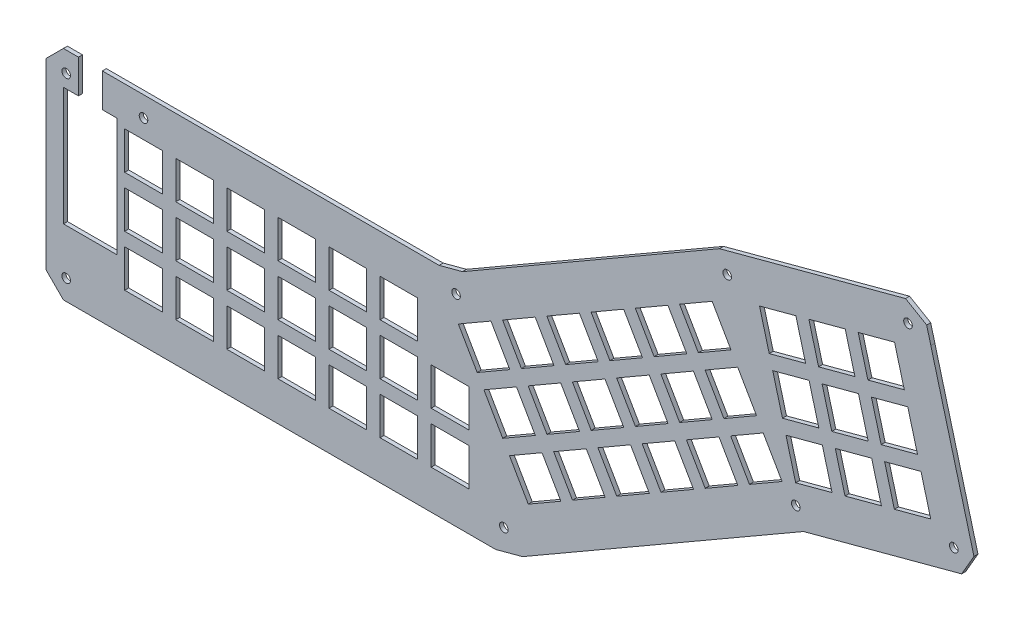
from build123d import *

# Parameters (mm, degrees)
ESQUISSE1_R        = 1.6
ESQUISSE1_W        = 14
ESQUISSE1_H        = 14
BOSS_EXTRU_1_DEPTH = 1.5


with BuildPart() as part:
    # Esquisse1 → Boss.-Extru.1 (new body)
    with BuildSketch(Plane.XY):
        Polygon((-76.753762562, 39.085106383), (-82.309962184, 39.085106383), (-82.309962184, 51.585106383), (-75.988646329, 51.585106383), (42.975455994, 51.585106383), (51.669750275, 53.914735514), (147.250925797, 109.098552931), (210.540810955, 126.057026548), (216.430520531, 127.635169473), (224.324263617, 123.047292559), (225.851989006, 117.211223452), (230.508864659, 99.83152691), (241.906099495, 57.296467436), (237.335031683, 49.379145741), (178.515758799, 33.618569072), (73.963816863, -26.744522748), (63.997857106, -29.414893617), (-96.789296468, -29.414893617), (-103.253762562, -22.950427523), (-103.253762562, 35.79522772), (-103.253762562, 45.120640289), (-96.789296468, 51.585106383), (-91.19756294, 51.585106383), (-91.19756294, 39.085106383), (-96.753762562, 39.085106383), (-96.753762562, -4.914893617), (-76.753762562, -4.914893617), align=None)
        with Locations((-95.753762562, 44.085106383)):
            Circle(ESQUISSE1_R, mode=Mode.SUBTRACT)
        with Locations((-66.988646329, 44.085106383)):
            Circle(ESQUISSE1_R, mode=Mode.SUBTRACT)
        with Locations((-95.753762562, -21.914893617)):
            Circle(ESQUISSE1_R, mode=Mode.SUBTRACT)
        with Locations((67.039694146, -20.835264486)):
            Circle(ESQUISSE1_R, mode=Mode.SUBTRACT)
        with Locations((49.263745973, 45.505477252)):
            Circle(ESQUISSE1_R, mode=Mode.SUBTRACT)
        with Locations((175.637377655, 40.567595866)):
            Circle(ESQUISSE1_R, mode=Mode.SUBTRACT)
        with Locations((150.12930694, 102.149526137)):
            Circle(ESQUISSE1_R, mode=Mode.SUBTRACT)
        with Locations((217.363403759, 120.120565138)):
            Circle(ESQUISSE1_R, mode=Mode.SUBTRACT)
        with Locations((234.393639901, 56.355573542)):
            Circle(ESQUISSE1_R, mode=Mode.SUBTRACT)
        with Locations((-66.988646329, 11.085106383)):
            Rectangle(ESQUISSE1_W, ESQUISSE1_H, mode=Mode.SUBTRACT)
        with Locations((-66.988646329, 30.085106383)):
            Rectangle(ESQUISSE1_W, ESQUISSE1_H, mode=Mode.SUBTRACT)
        with Locations((-66.988646329, -7.914893617)):
            Rectangle(ESQUISSE1_W, ESQUISSE1_H, mode=Mode.SUBTRACT)
        with Locations((-47.988646329, 11.085106383)):
            Rectangle(ESQUISSE1_W, ESQUISSE1_H, mode=Mode.SUBTRACT)
        with Locations((-47.988646329, 30.085106383)):
            Rectangle(ESQUISSE1_W, ESQUISSE1_H, mode=Mode.SUBTRACT)
        with Locations((-47.988646329, -7.914893617)):
            Rectangle(ESQUISSE1_W, ESQUISSE1_H, mode=Mode.SUBTRACT)
        with Locations((-28.988646329, 11.085106383)):
            Rectangle(ESQUISSE1_W, ESQUISSE1_H, mode=Mode.SUBTRACT)
        with Locations((-28.988646329, 30.085106383)):
            Rectangle(ESQUISSE1_W, ESQUISSE1_H, mode=Mode.SUBTRACT)
        with Locations((-28.988646329, -7.914893617)):
            Rectangle(ESQUISSE1_W, ESQUISSE1_H, mode=Mode.SUBTRACT)
        with Locations((-9.988646329, 11.085106383)):
            Rectangle(ESQUISSE1_W, ESQUISSE1_H, mode=Mode.SUBTRACT)
        with Locations((-9.988646329, 30.085106383)):
            Rectangle(ESQUISSE1_W, ESQUISSE1_H, mode=Mode.SUBTRACT)
        with Locations((-9.988646329, -7.914893617)):
            Rectangle(ESQUISSE1_W, ESQUISSE1_H, mode=Mode.SUBTRACT)
        with Locations((9.011353671, 11.085106383)):
            Rectangle(ESQUISSE1_W, ESQUISSE1_H, mode=Mode.SUBTRACT)
        with Locations((9.011353671, 30.085106383)):
            Rectangle(ESQUISSE1_W, ESQUISSE1_H, mode=Mode.SUBTRACT)
        with Locations((9.011353671, -7.914893617)):
            Rectangle(ESQUISSE1_W, ESQUISSE1_H, mode=Mode.SUBTRACT)
        with Locations((28.011353671, 11.085106383)):
            Rectangle(ESQUISSE1_W, ESQUISSE1_H, mode=Mode.SUBTRACT)
        with Locations((28.011353671, 30.085106383)):
            Rectangle(ESQUISSE1_W, ESQUISSE1_H, mode=Mode.SUBTRACT)
        with Locations((28.011353671, -7.914893617)):
            Rectangle(ESQUISSE1_W, ESQUISSE1_H, mode=Mode.SUBTRACT)
        with Locations((47.011353671, 11.085106383)):
            Rectangle(ESQUISSE1_W, ESQUISSE1_H, mode=Mode.SUBTRACT)
        with Locations((47.011353671, -7.914893617)):
            Rectangle(ESQUISSE1_W, ESQUISSE1_H, mode=Mode.SUBTRACT)
        Polygon((69.12536992, 3.37096395), (76.12536992, -8.753391703), (88.249725572, -1.753391703), (81.249725572, 10.37096395), align=None, mode=Mode.SUBTRACT)
        Polygon((59.62536992, 19.825446622), (66.62536992, 7.701090969), (78.749725572, 14.701090969), (71.749725572, 26.825446622), align=None, mode=Mode.SUBTRACT)
        Polygon((50.12536992, 36.279929294), (57.12536992, 24.155573641), (69.249725572, 31.155573641), (62.249725572, 43.279929294), align=None, mode=Mode.SUBTRACT)
        Polygon((85.579852591, 12.87096395), (92.579852591, 0.746608297), (104.704208244, 7.746608297), (97.704208244, 19.87096395), align=None, mode=Mode.SUBTRACT)
        Polygon((76.079852591, 29.325446622), (83.079852591, 17.201090969), (95.204208244, 24.201090969), (88.204208244, 36.325446622), align=None, mode=Mode.SUBTRACT)
        Polygon((66.579852591, 45.779929294), (73.579852591, 33.655573641), (85.704208244, 40.655573641), (78.704208244, 52.779929294), align=None, mode=Mode.SUBTRACT)
        Polygon((102.034335263, 22.37096395), (109.034335263, 10.246608297), (121.158690916, 17.246608297), (114.158690916, 29.37096395), align=None, mode=Mode.SUBTRACT)
        Polygon((92.534335263, 38.825446622), (99.534335263, 26.701090969), (111.658690916, 33.701090969), (104.658690916, 45.825446622), align=None, mode=Mode.SUBTRACT)
        Polygon((83.034335263, 55.279929294), (90.034335263, 43.155573641), (102.158690916, 50.155573641), (95.158690916, 62.279929294), align=None, mode=Mode.SUBTRACT)
        Polygon((118.488817935, 31.87096395), (125.488817935, 19.746608297), (137.613173588, 26.746608297), (130.613173588, 38.87096395), align=None, mode=Mode.SUBTRACT)
        Polygon((108.988817935, 48.325446622), (115.988817935, 36.201090969), (128.113173588, 43.201090969), (121.113173588, 55.325446622), align=None, mode=Mode.SUBTRACT)
        Polygon((99.488817935, 64.779929294), (106.488817935, 52.655573641), (118.613173588, 59.655573641), (111.613173588, 71.779929294), align=None, mode=Mode.SUBTRACT)
        Polygon((134.943300607, 41.37096395), (141.943300607, 29.246608297), (154.06765626, 36.246608297), (147.06765626, 48.37096395), align=None, mode=Mode.SUBTRACT)
        Polygon((125.443300607, 57.825446622), (132.443300607, 45.701090969), (144.56765626, 52.701090969), (137.56765626, 64.825446622), align=None, mode=Mode.SUBTRACT)
        Polygon((115.943300607, 74.279929294), (122.943300607, 62.155573641), (135.06765626, 69.155573641), (128.06765626, 81.279929294), align=None, mode=Mode.SUBTRACT)
        Polygon((151.397783279, 50.87096395), (158.397783279, 38.746608297), (170.522138932, 45.746608297), (163.522138932, 57.87096395), align=None, mode=Mode.SUBTRACT)
        Polygon((141.897783279, 67.325446622), (148.897783279, 55.201090969), (161.022138932, 62.201090969), (154.022138932, 74.325446622), align=None, mode=Mode.SUBTRACT)
        Polygon((132.397783279, 83.779929294), (139.397783279, 71.655573641), (151.522138932, 78.655573641), (144.522138932, 90.779929294), align=None, mode=Mode.SUBTRACT)
        Polygon((167.051254346, 79.722282932), (180.574215914, 83.345749564), (184.197682546, 69.822787996), (170.674720978, 66.199321364), align=None, mode=Mode.SUBTRACT)
        Polygon((162.133692489, 98.074873632), (175.656654057, 101.698340263), (179.280120689, 88.175378695), (165.757159121, 84.551912064), align=None, mode=Mode.SUBTRACT)
        Polygon((171.968816203, 61.369692233), (185.491777771, 64.993158864), (189.115244403, 51.470197296), (175.592282834, 47.846730665), align=None, mode=Mode.SUBTRACT)
        Polygon((185.403845046, 84.639844789), (198.926806614, 88.263311421), (202.550273245, 74.740349853), (189.027311677, 71.116883221), align=None, mode=Mode.SUBTRACT)
        Polygon((180.486283189, 102.992435489), (194.009244757, 106.61590212), (197.632711388, 93.092940552), (184.10974982, 89.469473921), align=None, mode=Mode.SUBTRACT)
        Polygon((190.321406903, 66.28725409), (203.844368471, 69.910720721), (207.467835102, 56.387759153), (193.944873534, 52.764292522), align=None, mode=Mode.SUBTRACT)
        Polygon((203.756435745, 89.557406646), (217.279397313, 93.180873278), (220.902863945, 79.65791171), (207.379902377, 76.034445078), align=None, mode=Mode.SUBTRACT)
        Polygon((198.838873888, 107.909997346), (212.361835456, 111.533463977), (215.985302088, 98.010502409), (202.46234052, 94.387035778), align=None, mode=Mode.SUBTRACT)
        Polygon((208.673997602, 71.204815947), (222.19695917, 74.828282578), (225.820425801, 61.30532101), (212.297464233, 57.681854379), align=None, mode=Mode.SUBTRACT)
    extrude(amount=BOSS_EXTRU_1_DEPTH)


solid = part.part
